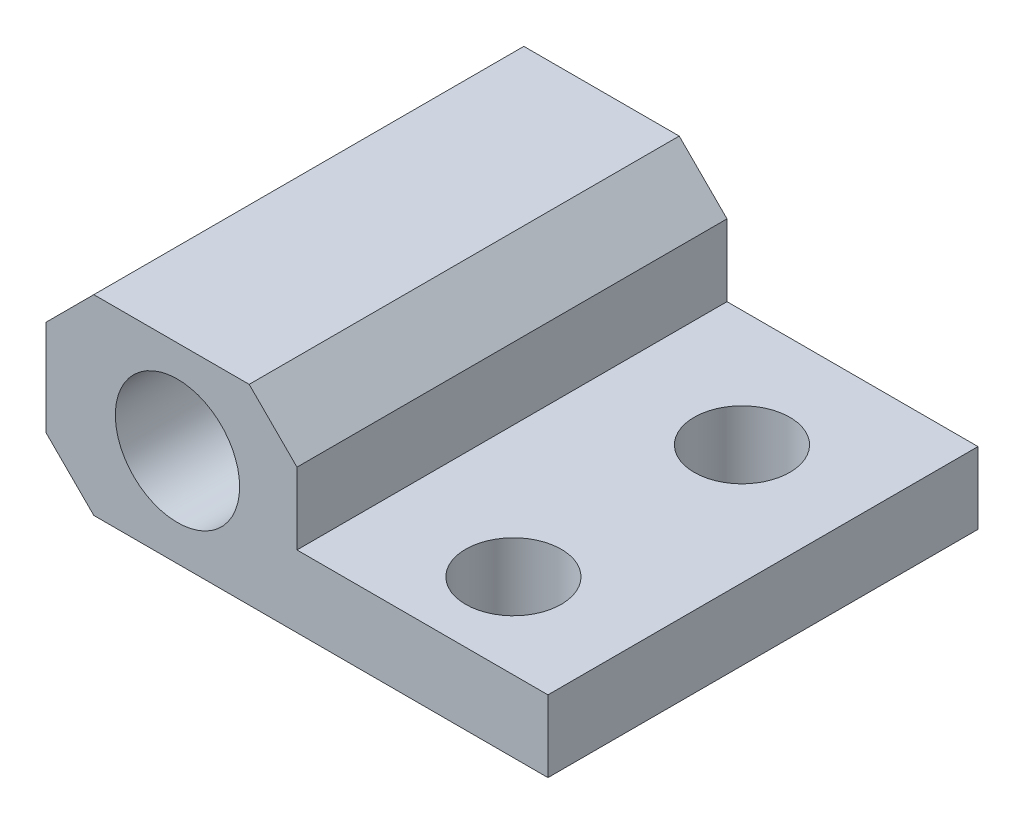
from build123d import *

# Parameters (mm, degrees)
SKETCH_1_W          = 21
SKETCH_1_H          = 17.990855805
EXTRUDE_1_DEPTH     = 8
SKETCH_2_W          = 10.499999995
SKETCH_2_H          = 17.994369167
CUT_EXTRUDE_1_DEPTH = 5
SKETCH_3_R          = 1.999999882
SKETCH_3_R_2        = 1.999999942
CUT_EXTRUDE_2_DEPTH = 22.671891763
SKETCH_4_R          = 2.6
CUT_EXTRUDE_3_DEPTH = 15
CHAMFER_1_SIZE      = 2


with BuildPart() as part:
    # Эскиз1 → Вытянуть1 (new body)
    with BuildSketch(Plane(origin=(0, 0, 0), x_dir=(1, 0, 0), z_dir=(0, 1, 0))):
        with Locations((-0.5, -8.995427903)):
            Rectangle(SKETCH_1_W, SKETCH_1_H)
    extrude(amount=EXTRUDE_1_DEPTH)

    # Эскиз2 → Вырез-Вытянуть1 (cut)
    with BuildSketch(Plane(origin=(0, 8, 0), x_dir=(1, 0, 0), z_dir=(0, 1, 0))):
        with Locations((4.749999998, -8.993671222)):
            Rectangle(SKETCH_2_W, SKETCH_2_H)
    extrude(amount=-CUT_EXTRUDE_1_DEPTH, mode=Mode.SUBTRACT)

    # Эскиз3 → Вырез-Вытянуть2 (cut, through all)
    with BuildSketch(Plane(origin=(0, 3, 0), x_dir=(1, 0, 0), z_dir=(0, 1, 0))):
        with Locations((4.999999995, -14.436118586)):
            Circle(SKETCH_3_R)
        with Locations((4.999999995, -4.873583798)):
            Circle(SKETCH_3_R_2)
    extrude(amount=-CUT_EXTRUDE_2_DEPTH, mode=Mode.SUBTRACT)

    # Эскиз4 → Вырез-Вытянуть3 (cut)
    with BuildSketch(Plane.XY.offset(17.990855805)):
        with Locations((-5.500000032, 4.090743194)):
            Circle(SKETCH_4_R)
    extrude(amount=-CUT_EXTRUDE_3_DEPTH, mode=Mode.SUBTRACT)

    # Фаска1
    chamfer_1_edges = [part.edges().sort_by_distance(p)[0] for p in [
        (-0.5, 8, 8.995427902),
        (-11, 0, 8.995427902),
        (-11, 8, 8.995427902),
    ]]
    chamfer(chamfer_1_edges, length=CHAMFER_1_SIZE)


solid = part.part
